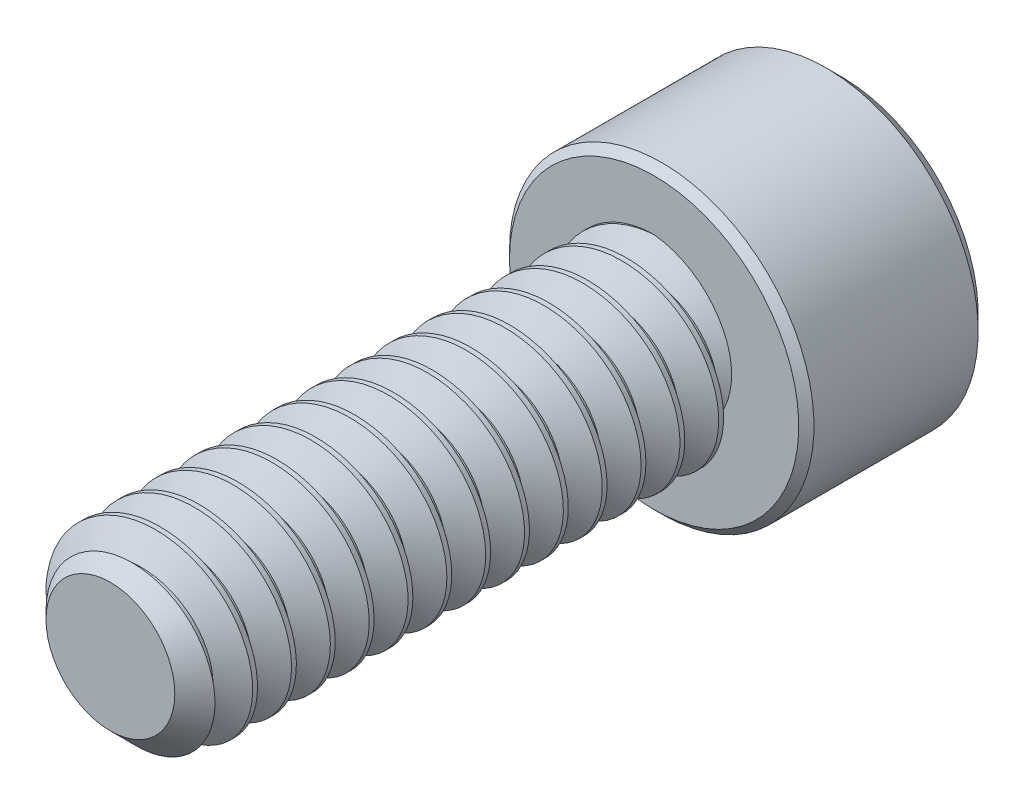
from build123d import *

# Parameters (mm, degrees)
SKETCH1_R          = 1.0922
EXTRUDE1_DEPTH     = 6.35
CHAMFER3_SIZE      = 0.340178571
CUT_SWEEP1_PITCH   = 0.453571429
SKETCH6_R          = 1.778
EXTRUDE2_DEPTH     = 2.1844
CUT_EXTRUDE1_DEPTH = 1.48828125
CHAMFER1_SIZE      = 0.1778
CHAMFER2_SIZE      = 0.0889


with BuildPart() as part:
    # Sketch1 → Extrude1 (new body)
    with BuildSketch(Plane.XY):
        Circle(SKETCH1_R)
    extrude(amount=-EXTRUDE1_DEPTH)

    # Chamfer3
    chamfer3_edges = [part.edges().sort_by_distance(p)[0] for p in [
        (-1.0922, 0, 0),
    ]]
    chamfer(chamfer3_edges, length=CHAMFER3_SIZE)

    # Cut-Sweep1: arcs per turn and ends read off the stored shape
    # Cut-Sweep1: the profile of Sketch3 profile screwed along a right-hand helix through 16 turns, 6 arcs to a turn; built about Z, then put on its axis
    cut_sweep1_z = Axis((0, 0, 0), (0, 0, 1))
    cut_sweep1_corners = [(1.0925, 0, -0.397048205), (0.797596715, 0, -0.226785714), (0.797596715, 0, -0.170089286), (1.0925, 0, 0.000173205)]
    with BuildLine(mode=Mode.PRIVATE) as cut_sweep1_profile:
        Line(cut_sweep1_corners[0], cut_sweep1_corners[1])
        Line(cut_sweep1_corners[1], cut_sweep1_corners[2])
        Line(cut_sweep1_corners[2], cut_sweep1_corners[3])
        Line(cut_sweep1_corners[3], cut_sweep1_corners[0])
    cut_sweep1_cap = Face(cut_sweep1_profile.wire())
    cut_sweep1_turn_angles = [0, 30, 60, 90, 120, 150, 180, 210, 240, 270, 300, 330, 360]
    cut_sweep1_turn_weights = [1, 0.8660254037844387, 1, 0.8660254037844387, 1, 0.8660254037844387, 1, 0.8660254037844387, 1, 0.8660254037844387, 1, 0.8660254037844387, 1]
    cut_sweep1_turn_rails = [Edge.make_bspline([Vector(p[0], p[1], 0).rotate(cut_sweep1_z, cut_sweep1_turn_angles[k]) / cut_sweep1_turn_weights[k] + Vector(0, 0, p[2] + CUT_SWEEP1_PITCH * cut_sweep1_turn_angles[k] / 360) for k in range(13)], [0, 0, 0, 1, 1, 2, 2, 3, 3, 4, 4, 5, 5, 6, 6, 6], 2, cut_sweep1_turn_weights) for p in cut_sweep1_corners]
    cut_sweep1_turn_sides = [Face.make_surface_from_curves(cut_sweep1_turn_rails[p[0]], cut_sweep1_turn_rails[p[1]]) for p in [(0, 1), (1, 2), (2, 3), (3, 0)]]
    cut_sweep1 = Plane(origin=(0, 0, 0), x_dir=(0, 1, 0), z_dir=(0, 0, -1)) * Solid(Shell([*[p.moved(Location((0, 0, CUT_SWEEP1_PITCH * i))) for i in range(16) for p in cut_sweep1_turn_sides], cut_sweep1_cap, cut_sweep1_cap.rotate(cut_sweep1_z, 5760).moved(Location((0, 0, CUT_SWEEP1_PITCH * 5760 / 360)))]))
    add(cut_sweep1, mode=Mode.SUBTRACT)

    # Sketch6 → Extrude2 (add)
    with BuildSketch(Plane(origin=(0, 0, -6.35), x_dir=(-1, 0, 0), z_dir=(0, 0, -1))):
        Circle(SKETCH6_R)
    extrude(amount=EXTRUDE2_DEPTH)

    # Sketch7 → Cut-Extrude1 (cut)
    with BuildSketch(Plane(origin=(0, 0, -8.5344), x_dir=(-1, 0, 0), z_dir=(0, 0, -1))):
        Polygon((0, 1.14567944), (-0.9921875, 0.57283972), (-0.9921875, -0.57283972), (0, -1.14567944), (0.9921875, -0.57283972), (0.9921875, 0.57283972), align=None)
    extrude(amount=-CUT_EXTRUDE1_DEPTH, mode=Mode.SUBTRACT)

    # Cut-Extrude2 cone 1 section (through the dimple's axis) → Cut-Extrude2 (revolve, cut)
    with BuildSketch(Plane(origin=(0, 0, -8.5344), x_dir=(0, 1, 0), z_dir=(1, 0, 0))):
        Polygon((0, 0), (1.14567944, 0), (0, 1.14567944), align=None)
    revolve(axis=Axis((0, 0, -8.5344), (0, 0, 1)), mode=Mode.SUBTRACT)

    # Chamfer1
    chamfer1_edges = [part.edges().sort_by_distance(p)[0] for p in [
        (1.778, 0, -8.5344),
    ]]
    chamfer(chamfer1_edges, length=CHAMFER1_SIZE)

    # Chamfer2
    chamfer2_edges = [part.edges().sort_by_distance(p)[0] for p in [
        (1.778, 0, -6.35),
    ]]
    chamfer(chamfer2_edges, length=CHAMFER2_SIZE)


solid = part.part
